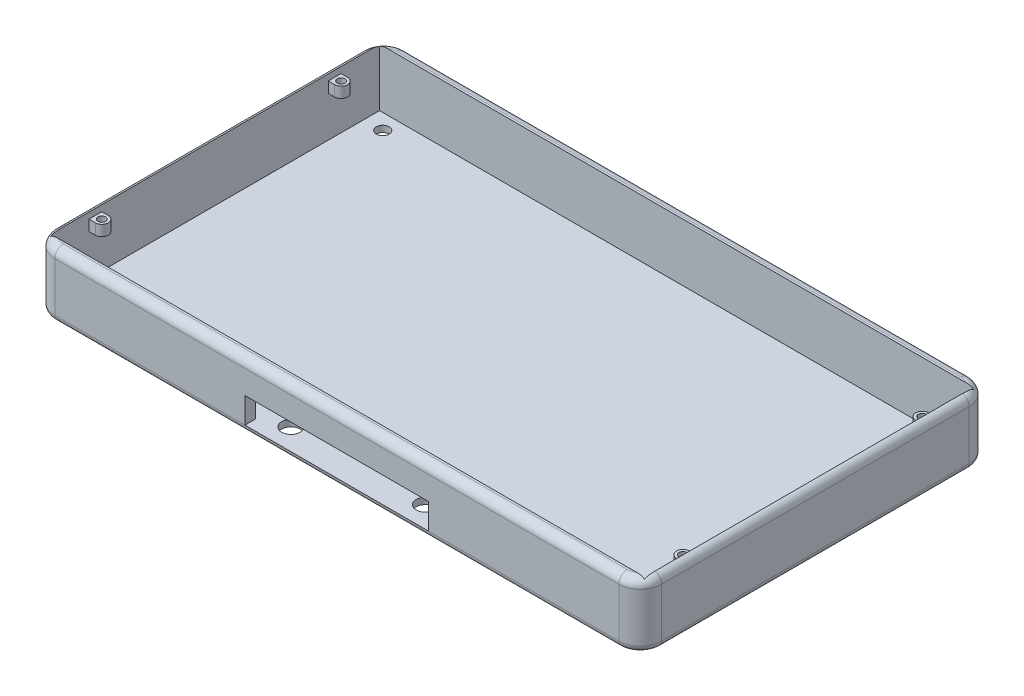
from build123d import *

# Parameters (mm, degrees)
SKETCH_1_W          = 142
SKETCH_1_H          = 82
EXTRUDE_1_DEPTH     = 15
SHELL_1_T           = -1.5
SKETCH_2_R          = 2.15
CUT_EXTRUDE_1_DEPTH = 15
SKETCH_4_R          = 1.5
CUT_EXTRUDE_2_DEPTH = 15
SKETCH_5_W          = 43
SKETCH_5_H          = 6
CUT_EXTRUDE_3_DEPTH = 15
SKETCH_6_W          = 3
SKETCH_6_H          = 3
EXTRUDE_2_DEPTH     = 2.5
CUT_EXTRUDE_4_REACH = 166.53
SKETCH_7_R          = 0.9
SKETCH_7_R_2        = 0.902391506
FILLET_4_RADIUS     = 1.5
FILLET_4_LENGTH     = 2.5
FILLET_5_RADIUS     = 1.5
FILLET_5_LENGTH     = 2.5
FILLET_6_RADIUS     = 1.5
FILLET_6_LENGTH     = 2.5
FILLET_7_RADIUS     = 1.5
FILLET_7_LENGTH     = 2.5
FILLET_8_R          = 5
FILLET_13_R         = 1.5
SKETCH_8_W          = 139
SKETCH_8_H          = 1
EXTRUDE_7_DEPTH     = 13.5
SKETCH_9_W          = 43
SKETCH_9_H          = 1
EXTRUDE_8_DEPTH     = 7.5
SKETCH_10_W         = 48
SKETCH_10_H         = 1
EXTRUDE_9_DEPTH     = 13.5
FILLET_14_R         = 2


# Some blends are built 0.0001 mm under size
with BuildPart() as part:
    # 草图1 → 凸台-拉伸1 (new body)
    with BuildSketch(Plane(origin=(0, 0, 0), x_dir=(1, 0, 0), z_dir=(0, 1, 0))):
        with Locations((71, -41)):
            Rectangle(SKETCH_1_W, SKETCH_1_H)
    extrude(amount=EXTRUDE_1_DEPTH)

    # 抽壳1
    shell_1_openings = [part.faces().sort_by_distance(p)[0] for p in [
        (71, 15, 41),
    ]]
    offset(amount=SHELL_1_T, openings=shell_1_openings, kind=Kind.INTERSECTION)

    # 草图2 → 切除-拉伸1 (cut)
    with BuildSketch(Plane(origin=(0, 1.5, 0), x_dir=(1, 0, 0), z_dir=(0, 1, 0))):
        with Locations(Location((86.75, -77, 0), (0, 0, 270))):
            Circle(SKETCH_2_R)
        with Locations(Location((55.25, -77, 0), (0, 0, 270))):
            Circle(SKETCH_2_R)
    extrude(amount=-CUT_EXTRUDE_1_DEPTH, mode=Mode.SUBTRACT)

    # 草图4 → 切除-拉伸2 (cut)
    with BuildSketch(Plane(origin=(0, 1.5, 0), x_dir=(1, 0, 0), z_dir=(0, 1, 0))):
        with Locations(Location((5.9, -75.85, 0), (0, 0, 270))):
            Circle(SKETCH_4_R)
        with Locations(Location((136.1, -75.85, 0), (0, 0, 270))):
            Circle(SKETCH_4_R)
        with Locations(Location((5.9, -6.15, 0), (0, 0, 270))):
            Circle(SKETCH_4_R)
        with Locations(Location((136.1, -6.15, 0), (0, 0, 270))):
            Circle(SKETCH_4_R)
    extrude(amount=-CUT_EXTRUDE_2_DEPTH, mode=Mode.SUBTRACT)

    # 草图5 → 切除-拉伸3 (cut)
    with BuildSketch(Plane.XY.offset(82)):
        with Locations((71, 4.5)):
            Rectangle(SKETCH_5_W, SKETCH_5_H)
    extrude(amount=-CUT_EXTRUDE_3_DEPTH, mode=Mode.SUBTRACT)

    # 草图6 → 凸台-拉伸2 (add)
    with BuildSketch(Plane(origin=(0, 11, 0), x_dir=(1, 0, 0), z_dir=(0, 1, 0))):
        with Locations((3, -69)):
            Rectangle(SKETCH_6_W, SKETCH_6_H)
        with Locations((3, -13)):
            Rectangle(SKETCH_6_W, SKETCH_6_H)
        with Locations((139, -13)):
            Rectangle(SKETCH_6_W, SKETCH_6_H)
        with Locations((139, -69)):
            Rectangle(SKETCH_6_W, SKETCH_6_H)
    extrude(amount=EXTRUDE_2_DEPTH)

    # 草图7 → 切除-拉伸4 (cut, up to next)
    with BuildSketch(Plane(origin=(0, 13.5, 0), x_dir=(1, 0, 0), z_dir=(0, 1, 0)), mode=Mode.PRIVATE) as cut_extrude_4_sk1:
        with Locations(Location((3, -13, 0), (0, 0, 270))):
            Circle(SKETCH_7_R)
    cut_extrude_4_tool1 = extrude(cut_extrude_4_sk1.sketch, amount=-CUT_EXTRUDE_4_REACH, mode=Mode.PRIVATE) & part.part
    # 草图7 → 切除-拉伸4 (cut, up to next)
    with BuildSketch(Plane(origin=(0, 13.5, 0), x_dir=(1, 0, 0), z_dir=(0, 1, 0)), mode=Mode.PRIVATE) as cut_extrude_4_sk2:
        with Locations(Location((3, -69, 0), (0, 0, 270))):
            Circle(SKETCH_7_R_2)
    cut_extrude_4_tool2 = extrude(cut_extrude_4_sk2.sketch, amount=-CUT_EXTRUDE_4_REACH, mode=Mode.PRIVATE) & part.part
    # 草图7 → 切除-拉伸4 (cut, up to next)
    with BuildSketch(Plane(origin=(0, 13.5, 0), x_dir=(1, 0, 0), z_dir=(0, 1, 0)), mode=Mode.PRIVATE) as cut_extrude_4_sk3:
        with Locations(Location((139, -69, 0), (0, 0, 270))):
            Circle(SKETCH_7_R)
    cut_extrude_4_tool3 = extrude(cut_extrude_4_sk3.sketch, amount=-CUT_EXTRUDE_4_REACH, mode=Mode.PRIVATE) & part.part
    # 草图7 → 切除-拉伸4 (cut, up to next)
    with BuildSketch(Plane(origin=(0, 13.5, 0), x_dir=(1, 0, 0), z_dir=(0, 1, 0)), mode=Mode.PRIVATE) as cut_extrude_4_sk4:
        with Locations(Location((139, -13, 0), (0, 0, 270))):
            Circle(SKETCH_7_R)
    cut_extrude_4_tool4 = extrude(cut_extrude_4_sk4.sketch, amount=-CUT_EXTRUDE_4_REACH, mode=Mode.PRIVATE) & part.part
    add(cut_extrude_4_tool1.solids().sort_by_distance((3, 13.5, 13))[0], mode=Mode.SUBTRACT)
    add(cut_extrude_4_tool2.solids().sort_by_distance((3, 13.5, 69))[0], mode=Mode.SUBTRACT)
    add(cut_extrude_4_tool3.solids().sort_by_distance((139, 13.5, 69))[0], mode=Mode.SUBTRACT)
    add(cut_extrude_4_tool4.solids().sort_by_distance((139, 13.5, 13))[0], mode=Mode.SUBTRACT)

    # 圆角4: full round fillet: the end face becomes a half cylinder, R = half its width
    fillet_4_face = Plane((4.5, 12.25, 13), x_dir=(0, -1, 0), z_dir=(1, 0, 0))  # on the end face: x along it, z out of the body
    fillet_4_slab = fillet_4_face.offset(-FILLET_4_RADIUS / 2) * Box(FILLET_4_LENGTH, 2 * FILLET_4_RADIUS, FILLET_4_RADIUS, mode=Mode.PRIVATE)  # the body's end, R deep
    fillet_4_round = Plane((3, 12.25, 13), x_dir=(1, 0, 0), z_dir=(0, -1, 0)) * Cylinder(FILLET_4_RADIUS, FILLET_4_LENGTH, mode=Mode.PRIVATE)  # its axis R under the face
    add(fillet_4_slab - fillet_4_round, mode=Mode.SUBTRACT)

    # 圆角5: full round fillet: the end face becomes a half cylinder, R = half its width
    fillet_5_face = Plane((4.5, 12.25, 69), x_dir=(0, -1, 0), z_dir=(1, 0, 0))  # on the end face: x along it, z out of the body
    fillet_5_slab = fillet_5_face.offset(-FILLET_5_RADIUS / 2) * Box(FILLET_5_LENGTH, 2 * FILLET_5_RADIUS, FILLET_5_RADIUS, mode=Mode.PRIVATE)  # the body's end, R deep
    fillet_5_round = Plane((3, 12.25, 69), x_dir=(1, 0, 0), z_dir=(0, -1, 0)) * Cylinder(FILLET_5_RADIUS, FILLET_5_LENGTH, mode=Mode.PRIVATE)  # its axis R under the face
    add(fillet_5_slab - fillet_5_round, mode=Mode.SUBTRACT)

    # 圆角6: full round fillet: the end face becomes a half cylinder, R = half its width
    fillet_6_face = Plane((137.5, 12.25, 13), x_dir=(0, -1, 0), z_dir=(-1, 0, 0))  # on the end face: x along it, z out of the body
    fillet_6_slab = fillet_6_face.offset(-FILLET_6_RADIUS / 2) * Box(FILLET_6_LENGTH, 2 * FILLET_6_RADIUS, FILLET_6_RADIUS, mode=Mode.PRIVATE)  # the body's end, R deep
    fillet_6_round = Plane((139, 12.25, 13), x_dir=(-1, 0, 0), z_dir=(0, -1, 0)) * Cylinder(FILLET_6_RADIUS, FILLET_6_LENGTH, mode=Mode.PRIVATE)  # its axis R under the face
    add(fillet_6_slab - fillet_6_round, mode=Mode.SUBTRACT)

    # 圆角7: full round fillet: the end face becomes a half cylinder, R = half its width
    fillet_7_face = Plane((137.5, 12.25, 69), x_dir=(0, -1, 0), z_dir=(-1, 0, 0))  # on the end face: x along it, z out of the body
    fillet_7_slab = fillet_7_face.offset(-FILLET_7_RADIUS / 2) * Box(FILLET_7_LENGTH, 2 * FILLET_7_RADIUS, FILLET_7_RADIUS, mode=Mode.PRIVATE)  # the body's end, R deep
    fillet_7_round = Plane((139, 12.25, 69), x_dir=(-1, 0, 0), z_dir=(0, -1, 0)) * Cylinder(FILLET_7_RADIUS, FILLET_7_LENGTH, mode=Mode.PRIVATE)  # its axis R under the face
    add(fillet_7_slab - fillet_7_round, mode=Mode.SUBTRACT)

    # 圆角8
    fillet_8_edges = [part.edges().sort_by_distance(p)[0] for p in [
        (0, 7.5, 0),
        (142, 7.5, 0),
        (142, 7.5, 82),
        (0, 7.5, 82),
    ]]
    fillet(fillet_8_edges, radius=FILLET_8_R)

    # 圆角13
    fillet_13_edges = [part.edges().sort_by_distance(p)[0] for p in [
        (71, 0, 82),
        (0, 0, 41),
        (71, 0, 0),
        (142, 0, 41),
        (140.535533906, 0, 80.535533906),
        (140.535533906, 0, 1.464466094),
        (1.464466094, 0, 1.464466094),
        (1.464466094, 0, 80.535533906),
    ]]
    fillet(fillet_13_edges, radius=FILLET_13_R - 0.0001)  # a hair under: the kernel refuses the full size

    # 草图8 → 凸台-拉伸7 (add)
    with BuildSketch(Plane(origin=(0, 15, 0), x_dir=(1, 0, 0), z_dir=(0, 1, 0))):
        with Locations((71, -2)):
            Rectangle(SKETCH_8_W, SKETCH_8_H)
    extrude(amount=-EXTRUDE_7_DEPTH)

    # 草图9 → 凸台-拉伸8 (add)
    with BuildSketch(Plane(origin=(0, 15, 0), x_dir=(1, 0, 0), z_dir=(0, 1, 0))):
        with Locations((71, -80)):
            Rectangle(SKETCH_9_W, SKETCH_9_H)
    extrude(amount=-EXTRUDE_8_DEPTH)

    # 草图10 → 凸台-拉伸9 (add)
    with BuildSketch(Plane(origin=(0, 15, 0), x_dir=(1, 0, 0), z_dir=(0, 1, 0))):
        with Locations((25.5, -80)):
            Rectangle(SKETCH_10_W, SKETCH_10_H)
        with Locations((116.5, -80)):
            Rectangle(SKETCH_10_W, SKETCH_10_H)
    extrude(amount=-EXTRUDE_9_DEPTH)

    # 圆角14
    # the kernel refuses this fillet: 2 mm, written as the material it takes off along each edge
    with BuildSketch(Plane(origin=(5, 15, 77), x_dir=(0, 0, 1), z_dir=(1, 0, 0))) as fillet_14_piece_1:
        with BuildLine():
            CenterArc((5 - FILLET_14_R, FILLET_14_R), FILLET_14_R, 270, 90)
            Line((5 - FILLET_14_R, 0), (5, 0))
            Line((5, 0), (5, FILLET_14_R))
        make_face()
    revolve(axis=Axis((5, 15, 77), (0, -1, 0)), revolution_arc=90, mode=Mode.SUBTRACT)
    with BuildSketch(Plane(origin=(5, 15, 5), x_dir=(0, 0, -1), z_dir=(1, 0, 0))) as fillet_14_piece_2:
        with BuildLine():
            CenterArc((5 - FILLET_14_R, -FILLET_14_R), FILLET_14_R, 0, 90)
            Line((5, -FILLET_14_R), (5, 0))
            Line((5, 0), (5 - FILLET_14_R, 0))
        make_face()
    revolve(axis=Axis((5, 15, 5), (0, 1, 0)), revolution_arc=90, mode=Mode.SUBTRACT)
    with BuildSketch(Plane(origin=(5, 15, 0), x_dir=(0, -1, 0), z_dir=(1, 0, 0)), Plane(origin=(137, 15, 82), x_dir=(0, -1, 0), z_dir=(-1, 0, 0))) as fillet_14_piece_3:
        with BuildLine():
            CenterArc((FILLET_14_R, -FILLET_14_R), FILLET_14_R, 90, 90)
            Line((0, -FILLET_14_R), (0, 0))
            Line((0, 0), (FILLET_14_R, 0))
        make_face()
    extrude(amount=132, mode=Mode.SUBTRACT)
    with BuildSketch(Plane(origin=(137, 15, 5), x_dir=(0, 0, -1), z_dir=(-1, 0, 0))) as fillet_14_piece_4:
        with BuildLine():
            CenterArc((5 - FILLET_14_R, FILLET_14_R), FILLET_14_R, 270, 90)
            Line((5 - FILLET_14_R, 0), (5, 0))
            Line((5, 0), (5, FILLET_14_R))
        make_face()
    revolve(axis=Axis((137, 15, 5), (0, -1, 0)), revolution_arc=90, mode=Mode.SUBTRACT)
    with BuildSketch(Plane(origin=(137, 15, 77), x_dir=(0, 0, 1), z_dir=(-1, 0, 0))) as fillet_14_piece_5:
        with BuildLine():
            CenterArc((5 - FILLET_14_R, -FILLET_14_R), FILLET_14_R, 0, 90)
            Line((5 - FILLET_14_R, 0), (5, 0))
            Line((5, 0), (5, -FILLET_14_R))
        make_face()
    revolve(axis=Axis((137, 15, 77), (0, 1, 0)), revolution_arc=90, mode=Mode.SUBTRACT)
    with BuildSketch(Plane(origin=(142, 15, 5), x_dir=(0, -1, 0), z_dir=(0, 0, 1)), Plane(origin=(0, 15, 77), x_dir=(0, -1, 0), z_dir=(0, 0, -1))) as fillet_14_piece_6:
        with BuildLine():
            CenterArc((FILLET_14_R, -FILLET_14_R), FILLET_14_R, 90, 90)
            Line((0, -FILLET_14_R), (0, 0))
            Line((0, 0), (FILLET_14_R, 0))
        make_face()
    extrude(amount=72, mode=Mode.SUBTRACT)


solid = part.part
